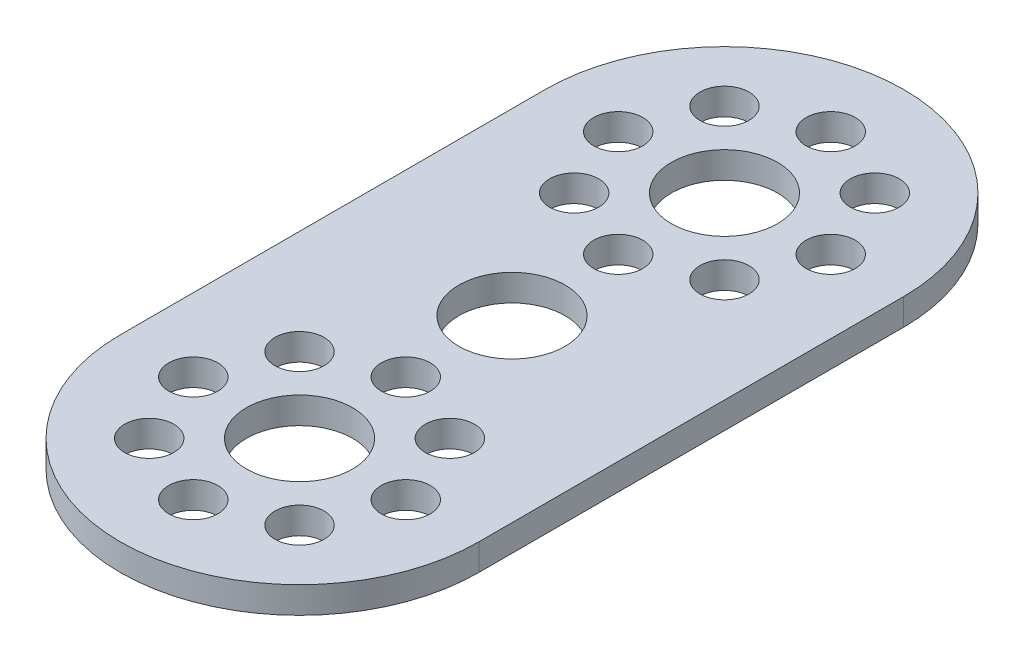
from build123d import *

# Parameters (mm, degrees)
EXTRUDE1_DEPTH = 2
SKETCH2_R      = 4
SKETCH2_R_2    = 1.85
EXTRUDE2_DEPTH = 2


with BuildPart() as part:
    # Sketch1 → Extrude1 (new body)
    with BuildSketch(Plane(origin=(0, 0, 0), x_dir=(1, 0, 0), z_dir=(0, 1, 0))):
        with BuildLine():
            Line((-13.5, 16), (-13.5, -16))
            ThreePointArc((-13.5, -16), (0, -29.5), (13.5, -16))
            Line((13.5, -16), (13.5, 16))
            ThreePointArc((13.5, 16), (0, 29.5), (-13.5, 16))
        make_face()
    extrude(amount=EXTRUDE1_DEPTH)

    # Sketch2 → Extrude2 (cut)
    with BuildSketch(Plane(origin=(0, 2, 0), x_dir=(1, 0, 0), z_dir=(0, 1, 0))):
        Circle(SKETCH2_R)
        with Locations((8, -16)):
            Circle(SKETCH2_R_2)
        with Locations((0, -24)):
            Circle(SKETCH2_R_2)
        with Locations((0, -16)):
            Circle(SKETCH2_R)
        with Locations((0, -8)):
            Circle(SKETCH2_R_2)
        with Locations((-5.66, -10.34)):
            Circle(SKETCH2_R_2)
        with Locations((-5.66, -21.66)):
            Circle(SKETCH2_R_2)
        with Locations((-8, -16)):
            Circle(SKETCH2_R_2)
        with Locations((5.66, -10.34)):
            Circle(SKETCH2_R_2)
        with Locations((5.66, -21.66)):
            Circle(SKETCH2_R_2)
        with Locations((8, 16)):
            Circle(SKETCH2_R_2)
        with Locations((0, 8)):
            Circle(SKETCH2_R_2)
        with Locations((0, 16)):
            Circle(SKETCH2_R)
        with Locations((0, 24)):
            Circle(SKETCH2_R_2)
        with Locations((-5.66, 21.66)):
            Circle(SKETCH2_R_2)
        with Locations((-5.66, 10.34)):
            Circle(SKETCH2_R_2)
        with Locations((-8, 16)):
            Circle(SKETCH2_R_2)
        with Locations((5.66, 21.66)):
            Circle(SKETCH2_R_2)
        with Locations((5.66, 10.34)):
            Circle(SKETCH2_R_2)
    extrude(amount=-EXTRUDE2_DEPTH, mode=Mode.SUBTRACT)


solid = part.part
